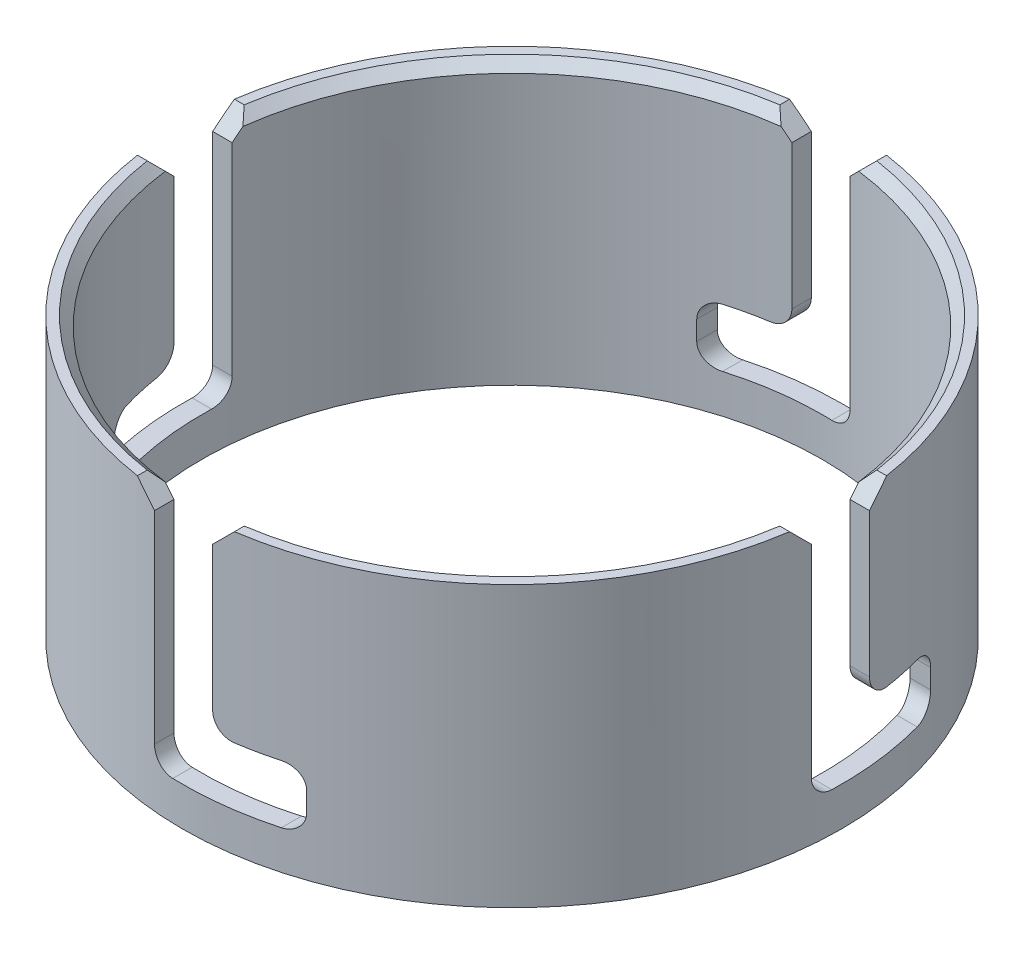
from build123d import *

# Parameters (mm, degrees)
SKETCH2_W                    = 5
SKETCH2_H                    = 72.15
CUT_EXTRUDE1_DEPTH           = 141.198304911
FILLET1_R                    = 5
CHAMFER1_SIZE                = 5
FILLET3_R                    = 5
CIRPATTERN1_COUNT            = 4
FILLET1_OF_CIRPATTERN1_R     = 5
CHAMFER1_OF_CIRPATTERN1_SIZE = 5
FILLET3_OF_CIRPATTERN1_R     = 5
CHAMFER2_SIZE                = 2.5


with BuildPart() as part:
    # Sketch2 → Revolve1 (revolve)
    with BuildSketch(Plane(origin=(0, 0, 0), x_dir=(0, 0, -1), z_dir=(1, 0, 0))):
        with Locations((-82.49983, 36.075)):
            Rectangle(SKETCH2_W, SKETCH2_H)
    revolve(axis=Axis((0, -3.6075, 0), (0, 1, 0)))

    # Sketch3 → Cut-Extrude1 (cut, through all)
    with BuildSketch(Plane(origin=(0, 0, 0), x_dir=(0, 0, -1), z_dir=(1, 0, 0))):
        Polygon((-7.5, 72.15), (7.5, 72.15), (7.5, 10), (-27.5, 10), (-27.5, 25), (-7.5, 25), align=None)
    cut_extrude1 = extrude(amount=-CUT_EXTRUDE1_DEPTH, mode=Mode.SUBTRACT)

    # Fillet1
    fillet1_edges = [part.edges().sort_by_distance(p)[0] for p in [
        (-82.157895651, 25, 7.5),
        (-82.157895651, 10, -7.5),
    ]]
    fillet(fillet1_edges, radius=FILLET1_R)

    # Chamfer1
    chamfer1_edges = [part.edges().sort_by_distance(p)[0] for p in [
        (-82.157895651, 72.15, 7.5),
        (-82.157895651, 72.15, -7.5),
    ]]
    chamfer(chamfer1_edges, length=CHAMFER1_SIZE)

    # Fillet3
    fillet3_edges = [part.edges().sort_by_distance(p)[0] for p in [
        (-77.776537511, 25, 27.5),
        (-77.776537511, 10, 27.5),
    ]]
    fillet(fillet3_edges, radius=FILLET3_R)

    # CirPattern1: Cut-Extrude1 ×4 about axis
    cirpattern1_axis = Axis((0, -3.6075, 0), (0, 1, 0))
    for i in range(1, CIRPATTERN1_COUNT):
        add(cut_extrude1.rotate(cirpattern1_axis, i * 360 / CIRPATTERN1_COUNT), mode=Mode.SUBTRACT)

    # Fillet1 of CirPattern1
    fillet1_of_cirpattern1_edges = [part.edges().sort_by_distance(p)[0] for p in [
        (7.5, 25, 82.157895651),
        (-7.5, 10, 82.157895651),
        (82.157895651, 25, -7.5),
        (82.157895651, 10, 7.5),
        (-7.5, 25, -82.157895651),
        (7.5, 10, -82.157895651),
    ]]
    fillet(fillet1_of_cirpattern1_edges, radius=FILLET1_OF_CIRPATTERN1_R)

    # Chamfer1 of CirPattern1
    chamfer1_of_cirpattern1_edges = [part.edges().sort_by_distance(p)[0] for p in [
        (7.5, 72.15, 82.157895651),
        (-7.5, 72.15, 82.157895651),
        (82.157895651, 72.15, -7.5),
        (82.157895651, 72.15, 7.5),
        (-7.5, 72.15, -82.157895651),
        (7.5, 72.15, -82.157895651),
    ]]
    chamfer(chamfer1_of_cirpattern1_edges, length=CHAMFER1_OF_CIRPATTERN1_SIZE)

    # Fillet3 of CirPattern1
    fillet3_of_cirpattern1_edges = [part.edges().sort_by_distance(p)[0] for p in [
        (27.5, 25, 77.776537511),
        (27.5, 10, 77.776537511),
        (77.776537511, 25, -27.5),
        (77.776537511, 10, -27.5),
        (-27.5, 25, -77.776537511),
        (-27.5, 10, -77.776537511),
    ]]
    fillet(fillet3_of_cirpattern1_edges, radius=FILLET3_OF_CIRPATTERN1_R)

    # Chamfer2
    chamfer2_edges = [part.edges().sort_by_distance(p)[0] for p in [
        (-56.568422287, 72.15, -56.568422287),
        (56.568422287, 72.15, -56.568422287),
        (56.568422287, 72.15, 56.568422287),
        (-56.568422287, 72.15, 56.568422287),
    ]]
    chamfer(chamfer2_edges, length=CHAMFER2_SIZE)


solid = part.part
